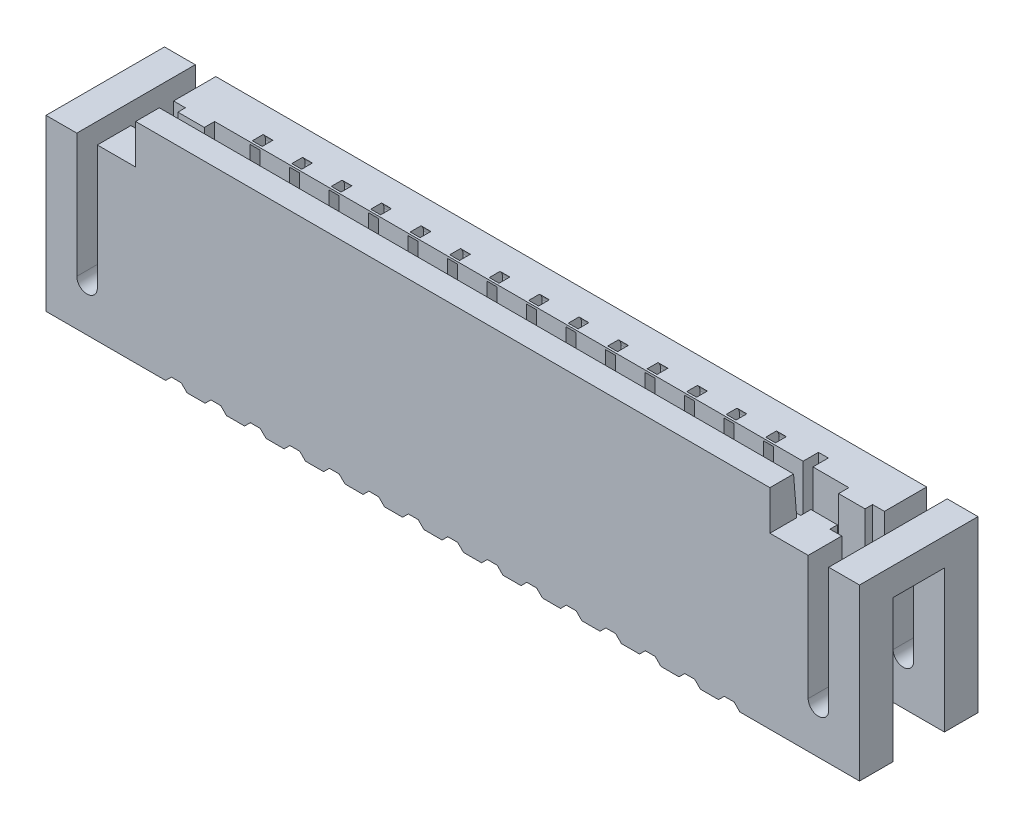
from build123d import *

# Parameters (mm, degrees)
BOSS_EXTRUDE1_DEPTH             = 3
CUT_EXTRUDE1_DEPTH              = 19.761966848
SKETCH3_W                       = 16.06
SKETCH3_H                       = 1.22
CUT_EXTRUDE2_DEPTH              = 3
CUT_EXTRUDE3_DEPTH              = 12.557681428
CUT_EXTRUDE3_DEPTH_BACK         = 12.557681428
F_1_1_START                     = -7.13
F_1_1_PART_1_METAL_PIN_DEPTH    = 0.25
F_1_1_START_2                   = -6.13
F_1_1_PART_1_METAL_PIN_2_DEPTH  = 0.25
F_1_1_START_3                   = -5.13
F_1_1_PART_1_METAL_PIN_3_DEPTH  = 0.25
F_1_1_START_4                   = -4.13
F_1_1_PART_1_METAL_PIN_4_DEPTH  = 0.25
F_1_1_START_5                   = -3.13
F_1_1_PART_1_METAL_PIN_5_DEPTH  = 0.25
F_1_1_START_6                   = -2.13
F_1_1_PART_1_METAL_PIN_6_DEPTH  = 0.25
F_1_1_START_7                   = -1.13
F_1_1_PART_1_METAL_PIN_7_DEPTH  = 0.25
F_1_1_START_8                   = -0.13
F_1_1_PART_1_METAL_PIN_8_DEPTH  = 0.25
F_1_1_START_9                   = 0.87
F_1_1_PART_1_METAL_PIN_9_DEPTH  = 0.25
F_1_1_START_10                  = 1.87
F_1_1_PART_1_METAL_PIN_10_DEPTH = 0.25
F_1_1_START_11                  = 2.87
F_1_1_PART_1_METAL_PIN_11_DEPTH = 0.25
F_1_1_START_12                  = 3.87
F_1_1_PART_1_METAL_PIN_12_DEPTH = 0.25
F_1_1_START_13                  = 4.87
F_1_1_PART_1_METAL_PIN_13_DEPTH = 0.25
F_1_1_START_14                  = 5.87
F_1_1_PART_1_METAL_PIN_14_DEPTH = 0.25
F_1_1_START_15                  = 6.87
F_1_1_PART_1_METAL_PIN_15_DEPTH = 0.25
SKETCH5_W                       = 1.3
SKETCH5_H                       = 3.6
CUT_EXTRUDE4_DEPTH              = 1.6
CUT_EXTRUDE5_DEPTH              = 1.6
SKETCH8_W                       = 0.3
SKETCH8_H                       = 1.3
BOSS_EXTRUDE3_DEPTH             = 0.3
CUT_EXTRUDE6_REACH              = 13.558
SKETCH9_W                       = 0.97
SKETCH9_H                       = 0.7
SKETCH10_W                      = 1.3
SKETCH10_H                      = 0.995055469
CUT_EXTRUDE7_DEPTH              = 0.3
SKETCH11_W                      = 1.3
SKETCH11_H                      = 1.339878891
CUT_EXTRUDE8_DEPTH              = 0.3
SKETCH12_W                      = 0.22
SKETCH12_H                      = 2.3
BOSS_EXTRUDE4_DEPTH             = 0.3


# Read off the part's stored shape, not the designer's step: 1.1 part 1 metal pin
with BuildPart() as part:
    # Sketch1 → Boss-Extrude1 (new body)
    with BuildSketch(Plane.XY):
        with BuildLine():
            Line((4.729085478, -2.65), (4.875, -2.504085478))
            Line((4.875, -2.504085478), (5.125, -2.504085478))
            Line((5.125, -2.504085478), (5.270914522, -2.65))
            Line((5.270914522, -2.65), (5.729085478, -2.65))
            Line((5.729085478, -2.65), (5.875, -2.504085478))
            Line((5.875, -2.504085478), (6.125, -2.504085478))
            Line((6.125, -2.504085478), (6.270914522, -2.65))
            Line((6.270914522, -2.65), (6.729085478, -2.65))
            Line((6.729085478, -2.65), (6.875, -2.504085478))
            Line((6.875, -2.504085478), (7.125, -2.504085478))
            Line((7.125, -2.504085478), (7.270914522, -2.65))
            Line((7.270914522, -2.65), (10.3, -2.65))
            Line((10.3, -2.65), (10.3, 1.65))
            Line((10.3, 1.65), (9.52, 1.65))
            Line((9.52, 1.65), (9.52, -1.49))
            ThreePointArc((9.52, -1.49), (9.26, -1.75), (9, -1.49))
            Line((9, -1.49), (9, 1.65))
            Line((9, 1.65), (8.03, 1.65))
            Line((8.03, 1.65), (8.03, 2.65))
            Line((8.03, 2.65), (-8.03, 2.65))
            Line((-8.03, 2.65), (-8.03, 1.65))
            Line((-8.03, 1.65), (-9, 1.65))
            Line((-9, 1.65), (-9, -1.49))
            ThreePointArc((-9, -1.49), (-9.26, -1.75), (-9.52, -1.49))
            Line((-9.52, -1.49), (-9.52, 1.65))
            Line((-9.52, 1.65), (-10.3, 1.65))
            Line((-10.3, 1.65), (-10.3, -2.65))
            Line((-10.3, -2.65), (-7.270914522, -2.65))
            Line((-7.270914522, -2.65), (-7.125, -2.504085478))
            Line((-7.125, -2.504085478), (-6.875, -2.504085478))
            Line((-6.875, -2.504085478), (-6.729085478, -2.65))
            Line((-6.729085478, -2.65), (-6.270914522, -2.65))
            Line((-6.270914522, -2.65), (-6.125, -2.504085478))
            Line((-6.125, -2.504085478), (-5.875, -2.504085478))
            Line((-5.875, -2.504085478), (-5.729085478, -2.65))
            Line((-5.729085478, -2.65), (-5.270914522, -2.65))
            Line((-5.270914522, -2.65), (-5.125, -2.504085478))
            Line((-5.125, -2.504085478), (-4.875, -2.504085478))
            Line((-4.875, -2.504085478), (-4.729085478, -2.65))
            Line((-4.729085478, -2.65), (-4.270914522, -2.65))
            Line((-4.270914522, -2.65), (-4.125, -2.504085478))
            Line((-4.125, -2.504085478), (-3.875, -2.504085478))
            Line((-3.875, -2.504085478), (-3.729085478, -2.65))
            Line((-3.729085478, -2.65), (-3.270914522, -2.65))
            Line((-3.270914522, -2.65), (-3.125, -2.504085478))
            Line((-3.125, -2.504085478), (-2.875, -2.504085478))
            Line((-2.875, -2.504085478), (-2.729085478, -2.65))
            Line((-2.729085478, -2.65), (-2.270914522, -2.65))
            Line((-2.270914522, -2.65), (-2.125, -2.504085478))
            Line((-2.125, -2.504085478), (-1.875, -2.504085478))
            Line((-1.875, -2.504085478), (-1.729085478, -2.65))
            Line((-1.729085478, -2.65), (-1.270914522, -2.65))
            Line((-1.270914522, -2.65), (-1.125, -2.504085478))
            Line((-1.125, -2.504085478), (-0.875, -2.504085478))
            Line((-0.875, -2.504085478), (-0.729085478, -2.65))
            Line((-0.729085478, -2.65), (-0.270914522, -2.65))
            Line((-0.270914522, -2.65), (-0.125, -2.504085478))
            Line((-0.125, -2.504085478), (0.125, -2.504085478))
            Line((0.125, -2.504085478), (0.270914522, -2.65))
            Line((0.270914522, -2.65), (0.729085478, -2.65))
            Line((0.729085478, -2.65), (0.875, -2.504085478))
            Line((0.875, -2.504085478), (1.125, -2.504085478))
            Line((1.125, -2.504085478), (1.270914522, -2.65))
            Line((1.270914522, -2.65), (1.729085478, -2.65))
            Line((1.729085478, -2.65), (1.875, -2.504085478))
            Line((1.875, -2.504085478), (2.125, -2.504085478))
            Line((2.125, -2.504085478), (2.270914522, -2.65))
            Line((2.270914522, -2.65), (2.729085478, -2.65))
            Line((2.729085478, -2.65), (2.875, -2.504085478))
            Line((2.875, -2.504085478), (3.125, -2.504085478))
            Line((3.125, -2.504085478), (3.270914522, -2.65))
            Line((3.270914522, -2.65), (3.729085478, -2.65))
            Line((3.729085478, -2.65), (3.875, -2.504085478))
            Line((3.875, -2.504085478), (4.125, -2.504085478))
            Line((4.125, -2.504085478), (4.270914522, -2.65))
            Line((4.270914522, -2.65), (4.729085478, -2.65))
        make_face()
    extrude(amount=BOSS_EXTRUDE1_DEPTH)

    # Sketch2 → Cut-Extrude1 (cut, through all)
    with BuildSketch(Plane(origin=(8.03, 0, 0), x_dir=(0, 0, -1), z_dir=(1, 0, 0))):
        Polygon((-2.4, 2.65), (-2.32, 1.65), (0.208388731, 1.65), (0.247686287, 2.908353898), align=None)
    extrude(amount=-CUT_EXTRUDE1_DEPTH, mode=Mode.SUBTRACT)

    # Sketch3 → Cut-Extrude2 (cut)
    with BuildSketch(Plane(origin=(0, 1.65, 0), x_dir=(1, 0, 0), z_dir=(0, 1, 0))):
        with Locations((0, -1.61)):
            Rectangle(SKETCH3_W, SKETCH3_H)
    extrude(amount=-CUT_EXTRUDE2_DEPTH, mode=Mode.SUBTRACT)

    # Sketch4 → Cut-Extrude3 (cut, two sides: drawn at the far end of the back side and taken through both)
    with BuildSketch(Plane(origin=(0, 1.65, 0), x_dir=(1, 0, 0), z_dir=(0, 1, 0)).offset(-CUT_EXTRUDE3_DEPTH_BACK)):
        Polygon((7.12, -1), (7.12, -0.61), (6.87, -0.61), (6.87, -1.06), (7.12, -1.06), align=None)
    extrude(amount=CUT_EXTRUDE3_DEPTH + CUT_EXTRUDE3_DEPTH_BACK, mode=Mode.SUBTRACT)


with BuildPart() as body_2:
    # 1.1 part 1 metal pin outline → 1.1 part 1 metal pin (new body)
    with BuildSketch(Plane.YZ.offset(F_1_1_START)):
        with BuildLine():
            Line((-1.194039738, 2.656451651), (-2.18961773, 2.656451651))
            Line((-2.18961773, 2.656451651), (-2.504085478, 2.970919399))
            Line((-2.504085478, 2.970919399), (-2.504085478, 3.951010546))
            ThreePointArc((-2.504085478, 3.951010546), (-2.677042739, 4.123967807), (-2.85, 3.951010546))
            Line((-2.85, 3.951010546), (-2.85, 2.60404036))
            Line((-2.85, 2.60404036), (-2.745177417, 2.570219382))
            Line((-2.745177417, 2.570219382), (-2.745177417, 0.672930638))
            Line((-2.745177417, 0.672930638), (-2.85, 0.612411291))
            Line((-2.85, 0.612411291), (-2.85, -0.52491373))
            ThreePointArc((-2.85, -0.52491373), (-2.677042739, -0.697870991), (-2.504085478, -0.52491373))
            Line((-2.504085478, -0.52491373), (-2.504085478, 0.245532252))
            Line((-2.504085478, 0.245532252), (-2.18961773, 0.56))
            Line((-2.18961773, 0.56), (-1.194039738, 0.56))
            Line((-1.194039738, 0.56), (-1.144039738, 0.61))
            Line((-1.144039738, 0.61), (1.504047418, 0.61))
            ThreePointArc((1.504047418, 0.61), (1.688823325, 0.733463313), (1.645468774, 0.951421356))
            Line((1.645468774, 0.951421356), (1.586890131, 1.01))
            Line((1.586890131, 1.01), (-0.7626457, 1.01))
            Line((-0.7626457, 1.01), (-0.9126457, 1.16))
            Line((-0.9126457, 1.16), (-1.165104327, 1.16))
            Line((-1.165104327, 1.16), (-1.265104327, 1.06))
            Line((-1.265104327, 1.06), (-1.766799307, 1.06))
            ThreePointArc((-1.766799307, 1.06), (-1.837509986, 1.089289321), (-1.866799307, 1.16))
            Line((-1.866799307, 1.16), (-1.866799307, 1.736611231))
            ThreePointArc((-1.866799307, 1.736611231), (-1.837509985, 1.807321909), (-1.766799307, 1.836611231))
            Line((-1.766799307, 1.836611231), (-1.261862956, 1.836611231))
            ThreePointArc((-1.261862956, 1.836611231), (-1.164124169, 1.800396685), (-1.066385382, 1.836611231))
            Line((-1.066385382, 1.836611231), (-0.709080744, 2.143526753))
            Line((-0.709080744, 2.143526753), (1.122327869, 1.918658051))
            ThreePointArc((1.122327869, 1.918658051), (1.262579084, 1.846243032), (1.416183018, 1.882577175))
            Line((1.416183018, 1.882577175), (1.815354631, 2.147954425))
            ThreePointArc((1.815354631, 2.147954425), (1.836330139, 2.201101995), (1.793766345, 2.239219702))
            Line((1.793766345, 2.239219702), (-1.136613148, 2.599025062))
            Line((-1.136613148, 2.599025062), (-1.194039738, 2.656451651))
        make_face()
    extrude(amount=F_1_1_PART_1_METAL_PIN_DEPTH)


with BuildPart() as body_3:
    # 1.1 part 1 metal pin 2 outline → 1.1 part 1 metal pin 2 (new body)
    with BuildSketch(Plane.YZ.offset(F_1_1_START_2)):
        with BuildLine():
            Line((-1.194039738, 2.656451651), (-2.18961773, 2.656451651))
            Line((-2.18961773, 2.656451651), (-2.504085478, 2.970919399))
            Line((-2.504085478, 2.970919399), (-2.504085478, 3.951010546))
            ThreePointArc((-2.504085478, 3.951010546), (-2.677042739, 4.123967807), (-2.85, 3.951010546))
            Line((-2.85, 3.951010546), (-2.85, 2.60404036))
            Line((-2.85, 2.60404036), (-2.745177417, 2.570219382))
            Line((-2.745177417, 2.570219382), (-2.745177417, 0.672930638))
            Line((-2.745177417, 0.672930638), (-2.85, 0.612411291))
            Line((-2.85, 0.612411291), (-2.85, -0.52491373))
            ThreePointArc((-2.85, -0.52491373), (-2.677042739, -0.697870991), (-2.504085478, -0.52491373))
            Line((-2.504085478, -0.52491373), (-2.504085478, 0.245532252))
            Line((-2.504085478, 0.245532252), (-2.18961773, 0.56))
            Line((-2.18961773, 0.56), (-1.194039738, 0.56))
            Line((-1.194039738, 0.56), (-1.144039738, 0.61))
            Line((-1.144039738, 0.61), (1.504047418, 0.61))
            ThreePointArc((1.504047418, 0.61), (1.688823325, 0.733463313), (1.645468774, 0.951421356))
            Line((1.645468774, 0.951421356), (1.586890131, 1.01))
            Line((1.586890131, 1.01), (-0.7626457, 1.01))
            Line((-0.7626457, 1.01), (-0.9126457, 1.16))
            Line((-0.9126457, 1.16), (-1.165104327, 1.16))
            Line((-1.165104327, 1.16), (-1.265104327, 1.06))
            Line((-1.265104327, 1.06), (-1.766799307, 1.06))
            ThreePointArc((-1.766799307, 1.06), (-1.837509986, 1.089289321), (-1.866799307, 1.16))
            Line((-1.866799307, 1.16), (-1.866799307, 1.736611231))
            ThreePointArc((-1.866799307, 1.736611231), (-1.837509985, 1.807321909), (-1.766799307, 1.836611231))
            Line((-1.766799307, 1.836611231), (-1.261862956, 1.836611231))
            ThreePointArc((-1.261862956, 1.836611231), (-1.164124169, 1.800396685), (-1.066385382, 1.836611231))
            Line((-1.066385382, 1.836611231), (-0.709080744, 2.143526753))
            Line((-0.709080744, 2.143526753), (1.122327869, 1.918658051))
            ThreePointArc((1.122327869, 1.918658051), (1.262579084, 1.846243032), (1.416183018, 1.882577175))
            Line((1.416183018, 1.882577175), (1.815354631, 2.147954425))
            ThreePointArc((1.815354631, 2.147954425), (1.836330139, 2.201101995), (1.793766345, 2.239219702))
            Line((1.793766345, 2.239219702), (-1.136613148, 2.599025062))
            Line((-1.136613148, 2.599025062), (-1.194039738, 2.656451651))
        make_face()
    extrude(amount=F_1_1_PART_1_METAL_PIN_2_DEPTH)


with BuildPart() as body_4:
    # 1.1 part 1 metal pin 3 outline → 1.1 part 1 metal pin 3 (new body)
    with BuildSketch(Plane.YZ.offset(F_1_1_START_3)):
        with BuildLine():
            Line((-1.194039738, 2.656451651), (-2.18961773, 2.656451651))
            Line((-2.18961773, 2.656451651), (-2.504085478, 2.970919399))
            Line((-2.504085478, 2.970919399), (-2.504085478, 3.951010546))
            ThreePointArc((-2.504085478, 3.951010546), (-2.677042739, 4.123967807), (-2.85, 3.951010546))
            Line((-2.85, 3.951010546), (-2.85, 2.60404036))
            Line((-2.85, 2.60404036), (-2.745177417, 2.570219382))
            Line((-2.745177417, 2.570219382), (-2.745177417, 0.672930638))
            Line((-2.745177417, 0.672930638), (-2.85, 0.612411291))
            Line((-2.85, 0.612411291), (-2.85, -0.52491373))
            ThreePointArc((-2.85, -0.52491373), (-2.677042739, -0.697870991), (-2.504085478, -0.52491373))
            Line((-2.504085478, -0.52491373), (-2.504085478, 0.245532252))
            Line((-2.504085478, 0.245532252), (-2.18961773, 0.56))
            Line((-2.18961773, 0.56), (-1.194039738, 0.56))
            Line((-1.194039738, 0.56), (-1.144039738, 0.61))
            Line((-1.144039738, 0.61), (1.504047418, 0.61))
            ThreePointArc((1.504047418, 0.61), (1.688823325, 0.733463313), (1.645468774, 0.951421356))
            Line((1.645468774, 0.951421356), (1.586890131, 1.01))
            Line((1.586890131, 1.01), (-0.7626457, 1.01))
            Line((-0.7626457, 1.01), (-0.9126457, 1.16))
            Line((-0.9126457, 1.16), (-1.165104327, 1.16))
            Line((-1.165104327, 1.16), (-1.265104327, 1.06))
            Line((-1.265104327, 1.06), (-1.766799307, 1.06))
            ThreePointArc((-1.766799307, 1.06), (-1.837509986, 1.089289321), (-1.866799307, 1.16))
            Line((-1.866799307, 1.16), (-1.866799307, 1.736611231))
            ThreePointArc((-1.866799307, 1.736611231), (-1.837509985, 1.807321909), (-1.766799307, 1.836611231))
            Line((-1.766799307, 1.836611231), (-1.261862956, 1.836611231))
            ThreePointArc((-1.261862956, 1.836611231), (-1.164124169, 1.800396685), (-1.066385382, 1.836611231))
            Line((-1.066385382, 1.836611231), (-0.709080744, 2.143526753))
            Line((-0.709080744, 2.143526753), (1.122327869, 1.918658051))
            ThreePointArc((1.122327869, 1.918658051), (1.262579084, 1.846243032), (1.416183018, 1.882577175))
            Line((1.416183018, 1.882577175), (1.815354631, 2.147954425))
            ThreePointArc((1.815354631, 2.147954425), (1.836330139, 2.201101995), (1.793766345, 2.239219702))
            Line((1.793766345, 2.239219702), (-1.136613148, 2.599025062))
            Line((-1.136613148, 2.599025062), (-1.194039738, 2.656451651))
        make_face()
    extrude(amount=F_1_1_PART_1_METAL_PIN_3_DEPTH)


with BuildPart() as body_5:
    # 1.1 part 1 metal pin 4 outline → 1.1 part 1 metal pin 4 (new body)
    with BuildSketch(Plane.YZ.offset(F_1_1_START_4)):
        with BuildLine():
            Line((-1.194039738, 2.656451651), (-2.18961773, 2.656451651))
            Line((-2.18961773, 2.656451651), (-2.504085478, 2.970919399))
            Line((-2.504085478, 2.970919399), (-2.504085478, 3.951010546))
            ThreePointArc((-2.504085478, 3.951010546), (-2.677042739, 4.123967807), (-2.85, 3.951010546))
            Line((-2.85, 3.951010546), (-2.85, 2.60404036))
            Line((-2.85, 2.60404036), (-2.745177417, 2.570219382))
            Line((-2.745177417, 2.570219382), (-2.745177417, 0.672930638))
            Line((-2.745177417, 0.672930638), (-2.85, 0.612411291))
            Line((-2.85, 0.612411291), (-2.85, -0.52491373))
            ThreePointArc((-2.85, -0.52491373), (-2.677042739, -0.697870991), (-2.504085478, -0.52491373))
            Line((-2.504085478, -0.52491373), (-2.504085478, 0.245532252))
            Line((-2.504085478, 0.245532252), (-2.18961773, 0.56))
            Line((-2.18961773, 0.56), (-1.194039738, 0.56))
            Line((-1.194039738, 0.56), (-1.144039738, 0.61))
            Line((-1.144039738, 0.61), (1.504047418, 0.61))
            ThreePointArc((1.504047418, 0.61), (1.688823325, 0.733463313), (1.645468774, 0.951421356))
            Line((1.645468774, 0.951421356), (1.586890131, 1.01))
            Line((1.586890131, 1.01), (-0.7626457, 1.01))
            Line((-0.7626457, 1.01), (-0.9126457, 1.16))
            Line((-0.9126457, 1.16), (-1.165104327, 1.16))
            Line((-1.165104327, 1.16), (-1.265104327, 1.06))
            Line((-1.265104327, 1.06), (-1.766799307, 1.06))
            ThreePointArc((-1.766799307, 1.06), (-1.837509986, 1.089289321), (-1.866799307, 1.16))
            Line((-1.866799307, 1.16), (-1.866799307, 1.736611231))
            ThreePointArc((-1.866799307, 1.736611231), (-1.837509985, 1.807321909), (-1.766799307, 1.836611231))
            Line((-1.766799307, 1.836611231), (-1.261862956, 1.836611231))
            ThreePointArc((-1.261862956, 1.836611231), (-1.164124169, 1.800396685), (-1.066385382, 1.836611231))
            Line((-1.066385382, 1.836611231), (-0.709080744, 2.143526753))
            Line((-0.709080744, 2.143526753), (1.122327869, 1.918658051))
            ThreePointArc((1.122327869, 1.918658051), (1.262579084, 1.846243032), (1.416183018, 1.882577175))
            Line((1.416183018, 1.882577175), (1.815354631, 2.147954425))
            ThreePointArc((1.815354631, 2.147954425), (1.836330139, 2.201101995), (1.793766345, 2.239219702))
            Line((1.793766345, 2.239219702), (-1.136613148, 2.599025062))
            Line((-1.136613148, 2.599025062), (-1.194039738, 2.656451651))
        make_face()
    extrude(amount=F_1_1_PART_1_METAL_PIN_4_DEPTH)


with BuildPart() as body_6:
    # 1.1 part 1 metal pin 5 outline → 1.1 part 1 metal pin 5 (new body)
    with BuildSketch(Plane.YZ.offset(F_1_1_START_5)):
        with BuildLine():
            Line((-1.194039738, 2.656451651), (-2.18961773, 2.656451651))
            Line((-2.18961773, 2.656451651), (-2.504085478, 2.970919399))
            Line((-2.504085478, 2.970919399), (-2.504085478, 3.951010546))
            ThreePointArc((-2.504085478, 3.951010546), (-2.677042739, 4.123967807), (-2.85, 3.951010546))
            Line((-2.85, 3.951010546), (-2.85, 2.60404036))
            Line((-2.85, 2.60404036), (-2.745177417, 2.570219382))
            Line((-2.745177417, 2.570219382), (-2.745177417, 0.672930638))
            Line((-2.745177417, 0.672930638), (-2.85, 0.612411291))
            Line((-2.85, 0.612411291), (-2.85, -0.52491373))
            ThreePointArc((-2.85, -0.52491373), (-2.677042739, -0.697870991), (-2.504085478, -0.52491373))
            Line((-2.504085478, -0.52491373), (-2.504085478, 0.245532252))
            Line((-2.504085478, 0.245532252), (-2.18961773, 0.56))
            Line((-2.18961773, 0.56), (-1.194039738, 0.56))
            Line((-1.194039738, 0.56), (-1.144039738, 0.61))
            Line((-1.144039738, 0.61), (1.504047418, 0.61))
            ThreePointArc((1.504047418, 0.61), (1.688823325, 0.733463313), (1.645468774, 0.951421356))
            Line((1.645468774, 0.951421356), (1.586890131, 1.01))
            Line((1.586890131, 1.01), (-0.7626457, 1.01))
            Line((-0.7626457, 1.01), (-0.9126457, 1.16))
            Line((-0.9126457, 1.16), (-1.165104327, 1.16))
            Line((-1.165104327, 1.16), (-1.265104327, 1.06))
            Line((-1.265104327, 1.06), (-1.766799307, 1.06))
            ThreePointArc((-1.766799307, 1.06), (-1.837509986, 1.089289321), (-1.866799307, 1.16))
            Line((-1.866799307, 1.16), (-1.866799307, 1.736611231))
            ThreePointArc((-1.866799307, 1.736611231), (-1.837509985, 1.807321909), (-1.766799307, 1.836611231))
            Line((-1.766799307, 1.836611231), (-1.261862956, 1.836611231))
            ThreePointArc((-1.261862956, 1.836611231), (-1.164124169, 1.800396685), (-1.066385382, 1.836611231))
            Line((-1.066385382, 1.836611231), (-0.709080744, 2.143526753))
            Line((-0.709080744, 2.143526753), (1.122327869, 1.918658051))
            ThreePointArc((1.122327869, 1.918658051), (1.262579084, 1.846243032), (1.416183018, 1.882577175))
            Line((1.416183018, 1.882577175), (1.815354631, 2.147954425))
            ThreePointArc((1.815354631, 2.147954425), (1.836330139, 2.201101995), (1.793766345, 2.239219702))
            Line((1.793766345, 2.239219702), (-1.136613148, 2.599025062))
            Line((-1.136613148, 2.599025062), (-1.194039738, 2.656451651))
        make_face()
    extrude(amount=F_1_1_PART_1_METAL_PIN_5_DEPTH)


with BuildPart() as body_7:
    # 1.1 part 1 metal pin 6 outline → 1.1 part 1 metal pin 6 (new body)
    with BuildSketch(Plane.YZ.offset(F_1_1_START_6)):
        with BuildLine():
            Line((-1.194039738, 2.656451651), (-2.18961773, 2.656451651))
            Line((-2.18961773, 2.656451651), (-2.504085478, 2.970919399))
            Line((-2.504085478, 2.970919399), (-2.504085478, 3.951010546))
            ThreePointArc((-2.504085478, 3.951010546), (-2.677042739, 4.123967807), (-2.85, 3.951010546))
            Line((-2.85, 3.951010546), (-2.85, 2.60404036))
            Line((-2.85, 2.60404036), (-2.745177417, 2.570219382))
            Line((-2.745177417, 2.570219382), (-2.745177417, 0.672930638))
            Line((-2.745177417, 0.672930638), (-2.85, 0.612411291))
            Line((-2.85, 0.612411291), (-2.85, -0.52491373))
            ThreePointArc((-2.85, -0.52491373), (-2.677042739, -0.697870991), (-2.504085478, -0.52491373))
            Line((-2.504085478, -0.52491373), (-2.504085478, 0.245532252))
            Line((-2.504085478, 0.245532252), (-2.18961773, 0.56))
            Line((-2.18961773, 0.56), (-1.194039738, 0.56))
            Line((-1.194039738, 0.56), (-1.144039738, 0.61))
            Line((-1.144039738, 0.61), (1.504047418, 0.61))
            ThreePointArc((1.504047418, 0.61), (1.688823325, 0.733463313), (1.645468774, 0.951421356))
            Line((1.645468774, 0.951421356), (1.586890131, 1.01))
            Line((1.586890131, 1.01), (-0.7626457, 1.01))
            Line((-0.7626457, 1.01), (-0.9126457, 1.16))
            Line((-0.9126457, 1.16), (-1.165104327, 1.16))
            Line((-1.165104327, 1.16), (-1.265104327, 1.06))
            Line((-1.265104327, 1.06), (-1.766799307, 1.06))
            ThreePointArc((-1.766799307, 1.06), (-1.837509986, 1.089289321), (-1.866799307, 1.16))
            Line((-1.866799307, 1.16), (-1.866799307, 1.736611231))
            ThreePointArc((-1.866799307, 1.736611231), (-1.837509985, 1.807321909), (-1.766799307, 1.836611231))
            Line((-1.766799307, 1.836611231), (-1.261862956, 1.836611231))
            ThreePointArc((-1.261862956, 1.836611231), (-1.164124169, 1.800396685), (-1.066385382, 1.836611231))
            Line((-1.066385382, 1.836611231), (-0.709080744, 2.143526753))
            Line((-0.709080744, 2.143526753), (1.122327869, 1.918658051))
            ThreePointArc((1.122327869, 1.918658051), (1.262579084, 1.846243032), (1.416183018, 1.882577175))
            Line((1.416183018, 1.882577175), (1.815354631, 2.147954425))
            ThreePointArc((1.815354631, 2.147954425), (1.836330139, 2.201101995), (1.793766345, 2.239219702))
            Line((1.793766345, 2.239219702), (-1.136613148, 2.599025062))
            Line((-1.136613148, 2.599025062), (-1.194039738, 2.656451651))
        make_face()
    extrude(amount=F_1_1_PART_1_METAL_PIN_6_DEPTH)


with BuildPart() as body_8:
    # 1.1 part 1 metal pin 7 outline → 1.1 part 1 metal pin 7 (new body)
    with BuildSketch(Plane.YZ.offset(F_1_1_START_7)):
        with BuildLine():
            Line((-1.194039738, 2.656451651), (-2.18961773, 2.656451651))
            Line((-2.18961773, 2.656451651), (-2.504085478, 2.970919399))
            Line((-2.504085478, 2.970919399), (-2.504085478, 3.951010546))
            ThreePointArc((-2.504085478, 3.951010546), (-2.677042739, 4.123967807), (-2.85, 3.951010546))
            Line((-2.85, 3.951010546), (-2.85, 2.60404036))
            Line((-2.85, 2.60404036), (-2.745177417, 2.570219382))
            Line((-2.745177417, 2.570219382), (-2.745177417, 0.672930638))
            Line((-2.745177417, 0.672930638), (-2.85, 0.612411291))
            Line((-2.85, 0.612411291), (-2.85, -0.52491373))
            ThreePointArc((-2.85, -0.52491373), (-2.677042739, -0.697870991), (-2.504085478, -0.52491373))
            Line((-2.504085478, -0.52491373), (-2.504085478, 0.245532252))
            Line((-2.504085478, 0.245532252), (-2.18961773, 0.56))
            Line((-2.18961773, 0.56), (-1.194039738, 0.56))
            Line((-1.194039738, 0.56), (-1.144039738, 0.61))
            Line((-1.144039738, 0.61), (1.504047418, 0.61))
            ThreePointArc((1.504047418, 0.61), (1.688823325, 0.733463313), (1.645468774, 0.951421356))
            Line((1.645468774, 0.951421356), (1.586890131, 1.01))
            Line((1.586890131, 1.01), (-0.7626457, 1.01))
            Line((-0.7626457, 1.01), (-0.9126457, 1.16))
            Line((-0.9126457, 1.16), (-1.165104327, 1.16))
            Line((-1.165104327, 1.16), (-1.265104327, 1.06))
            Line((-1.265104327, 1.06), (-1.766799307, 1.06))
            ThreePointArc((-1.766799307, 1.06), (-1.837509986, 1.089289321), (-1.866799307, 1.16))
            Line((-1.866799307, 1.16), (-1.866799307, 1.736611231))
            ThreePointArc((-1.866799307, 1.736611231), (-1.837509985, 1.807321909), (-1.766799307, 1.836611231))
            Line((-1.766799307, 1.836611231), (-1.261862956, 1.836611231))
            ThreePointArc((-1.261862956, 1.836611231), (-1.164124169, 1.800396685), (-1.066385382, 1.836611231))
            Line((-1.066385382, 1.836611231), (-0.709080744, 2.143526753))
            Line((-0.709080744, 2.143526753), (1.122327869, 1.918658051))
            ThreePointArc((1.122327869, 1.918658051), (1.262579084, 1.846243032), (1.416183018, 1.882577175))
            Line((1.416183018, 1.882577175), (1.815354631, 2.147954425))
            ThreePointArc((1.815354631, 2.147954425), (1.836330139, 2.201101995), (1.793766345, 2.239219702))
            Line((1.793766345, 2.239219702), (-1.136613148, 2.599025062))
            Line((-1.136613148, 2.599025062), (-1.194039738, 2.656451651))
        make_face()
    extrude(amount=F_1_1_PART_1_METAL_PIN_7_DEPTH)


with BuildPart() as body_9:
    # 1.1 part 1 metal pin 8 outline → 1.1 part 1 metal pin 8 (new body)
    with BuildSketch(Plane.YZ.offset(F_1_1_START_8)):
        with BuildLine():
            Line((-1.194039738, 2.656451651), (-2.18961773, 2.656451651))
            Line((-2.18961773, 2.656451651), (-2.504085478, 2.970919399))
            Line((-2.504085478, 2.970919399), (-2.504085478, 3.951010546))
            ThreePointArc((-2.504085478, 3.951010546), (-2.677042739, 4.123967807), (-2.85, 3.951010546))
            Line((-2.85, 3.951010546), (-2.85, 2.60404036))
            Line((-2.85, 2.60404036), (-2.745177417, 2.570219382))
            Line((-2.745177417, 2.570219382), (-2.745177417, 0.672930638))
            Line((-2.745177417, 0.672930638), (-2.85, 0.612411291))
            Line((-2.85, 0.612411291), (-2.85, -0.52491373))
            ThreePointArc((-2.85, -0.52491373), (-2.677042739, -0.697870991), (-2.504085478, -0.52491373))
            Line((-2.504085478, -0.52491373), (-2.504085478, 0.245532252))
            Line((-2.504085478, 0.245532252), (-2.18961773, 0.56))
            Line((-2.18961773, 0.56), (-1.194039738, 0.56))
            Line((-1.194039738, 0.56), (-1.144039738, 0.61))
            Line((-1.144039738, 0.61), (1.504047418, 0.61))
            ThreePointArc((1.504047418, 0.61), (1.688823325, 0.733463313), (1.645468774, 0.951421356))
            Line((1.645468774, 0.951421356), (1.586890131, 1.01))
            Line((1.586890131, 1.01), (-0.7626457, 1.01))
            Line((-0.7626457, 1.01), (-0.9126457, 1.16))
            Line((-0.9126457, 1.16), (-1.165104327, 1.16))
            Line((-1.165104327, 1.16), (-1.265104327, 1.06))
            Line((-1.265104327, 1.06), (-1.766799307, 1.06))
            ThreePointArc((-1.766799307, 1.06), (-1.837509986, 1.089289321), (-1.866799307, 1.16))
            Line((-1.866799307, 1.16), (-1.866799307, 1.736611231))
            ThreePointArc((-1.866799307, 1.736611231), (-1.837509985, 1.807321909), (-1.766799307, 1.836611231))
            Line((-1.766799307, 1.836611231), (-1.261862956, 1.836611231))
            ThreePointArc((-1.261862956, 1.836611231), (-1.164124169, 1.800396685), (-1.066385382, 1.836611231))
            Line((-1.066385382, 1.836611231), (-0.709080744, 2.143526753))
            Line((-0.709080744, 2.143526753), (1.122327869, 1.918658051))
            ThreePointArc((1.122327869, 1.918658051), (1.262579084, 1.846243032), (1.416183018, 1.882577175))
            Line((1.416183018, 1.882577175), (1.815354631, 2.147954425))
            ThreePointArc((1.815354631, 2.147954425), (1.836330139, 2.201101995), (1.793766345, 2.239219702))
            Line((1.793766345, 2.239219702), (-1.136613148, 2.599025062))
            Line((-1.136613148, 2.599025062), (-1.194039738, 2.656451651))
        make_face()
    extrude(amount=F_1_1_PART_1_METAL_PIN_8_DEPTH)


with BuildPart() as body_10:
    # 1.1 part 1 metal pin 9 outline → 1.1 part 1 metal pin 9 (new body)
    with BuildSketch(Plane.YZ.offset(F_1_1_START_9)):
        with BuildLine():
            Line((-1.194039738, 2.656451651), (-2.18961773, 2.656451651))
            Line((-2.18961773, 2.656451651), (-2.504085478, 2.970919399))
            Line((-2.504085478, 2.970919399), (-2.504085478, 3.951010546))
            ThreePointArc((-2.504085478, 3.951010546), (-2.677042739, 4.123967807), (-2.85, 3.951010546))
            Line((-2.85, 3.951010546), (-2.85, 2.60404036))
            Line((-2.85, 2.60404036), (-2.745177417, 2.570219382))
            Line((-2.745177417, 2.570219382), (-2.745177417, 0.672930638))
            Line((-2.745177417, 0.672930638), (-2.85, 0.612411291))
            Line((-2.85, 0.612411291), (-2.85, -0.52491373))
            ThreePointArc((-2.85, -0.52491373), (-2.677042739, -0.697870991), (-2.504085478, -0.52491373))
            Line((-2.504085478, -0.52491373), (-2.504085478, 0.245532252))
            Line((-2.504085478, 0.245532252), (-2.18961773, 0.56))
            Line((-2.18961773, 0.56), (-1.194039738, 0.56))
            Line((-1.194039738, 0.56), (-1.144039738, 0.61))
            Line((-1.144039738, 0.61), (1.504047418, 0.61))
            ThreePointArc((1.504047418, 0.61), (1.688823325, 0.733463313), (1.645468774, 0.951421356))
            Line((1.645468774, 0.951421356), (1.586890131, 1.01))
            Line((1.586890131, 1.01), (-0.7626457, 1.01))
            Line((-0.7626457, 1.01), (-0.9126457, 1.16))
            Line((-0.9126457, 1.16), (-1.165104327, 1.16))
            Line((-1.165104327, 1.16), (-1.265104327, 1.06))
            Line((-1.265104327, 1.06), (-1.766799307, 1.06))
            ThreePointArc((-1.766799307, 1.06), (-1.837509986, 1.089289321), (-1.866799307, 1.16))
            Line((-1.866799307, 1.16), (-1.866799307, 1.736611231))
            ThreePointArc((-1.866799307, 1.736611231), (-1.837509985, 1.807321909), (-1.766799307, 1.836611231))
            Line((-1.766799307, 1.836611231), (-1.261862956, 1.836611231))
            ThreePointArc((-1.261862956, 1.836611231), (-1.164124169, 1.800396685), (-1.066385382, 1.836611231))
            Line((-1.066385382, 1.836611231), (-0.709080744, 2.143526753))
            Line((-0.709080744, 2.143526753), (1.122327869, 1.918658051))
            ThreePointArc((1.122327869, 1.918658051), (1.262579084, 1.846243032), (1.416183018, 1.882577175))
            Line((1.416183018, 1.882577175), (1.815354631, 2.147954425))
            ThreePointArc((1.815354631, 2.147954425), (1.836330139, 2.201101995), (1.793766345, 2.239219702))
            Line((1.793766345, 2.239219702), (-1.136613148, 2.599025062))
            Line((-1.136613148, 2.599025062), (-1.194039738, 2.656451651))
        make_face()
    extrude(amount=F_1_1_PART_1_METAL_PIN_9_DEPTH)


with BuildPart() as body_11:
    # 1.1 part 1 metal pin 10 outline → 1.1 part 1 metal pin 10 (new body)
    with BuildSketch(Plane.YZ.offset(F_1_1_START_10)):
        with BuildLine():
            Line((-1.194039738, 2.656451651), (-2.18961773, 2.656451651))
            Line((-2.18961773, 2.656451651), (-2.504085478, 2.970919399))
            Line((-2.504085478, 2.970919399), (-2.504085478, 3.951010546))
            ThreePointArc((-2.504085478, 3.951010546), (-2.677042739, 4.123967807), (-2.85, 3.951010546))
            Line((-2.85, 3.951010546), (-2.85, 2.60404036))
            Line((-2.85, 2.60404036), (-2.745177417, 2.570219382))
            Line((-2.745177417, 2.570219382), (-2.745177417, 0.672930638))
            Line((-2.745177417, 0.672930638), (-2.85, 0.612411291))
            Line((-2.85, 0.612411291), (-2.85, -0.52491373))
            ThreePointArc((-2.85, -0.52491373), (-2.677042739, -0.697870991), (-2.504085478, -0.52491373))
            Line((-2.504085478, -0.52491373), (-2.504085478, 0.245532252))
            Line((-2.504085478, 0.245532252), (-2.18961773, 0.56))
            Line((-2.18961773, 0.56), (-1.194039738, 0.56))
            Line((-1.194039738, 0.56), (-1.144039738, 0.61))
            Line((-1.144039738, 0.61), (1.504047418, 0.61))
            ThreePointArc((1.504047418, 0.61), (1.688823325, 0.733463313), (1.645468774, 0.951421356))
            Line((1.645468774, 0.951421356), (1.586890131, 1.01))
            Line((1.586890131, 1.01), (-0.7626457, 1.01))
            Line((-0.7626457, 1.01), (-0.9126457, 1.16))
            Line((-0.9126457, 1.16), (-1.165104327, 1.16))
            Line((-1.165104327, 1.16), (-1.265104327, 1.06))
            Line((-1.265104327, 1.06), (-1.766799307, 1.06))
            ThreePointArc((-1.766799307, 1.06), (-1.837509986, 1.089289321), (-1.866799307, 1.16))
            Line((-1.866799307, 1.16), (-1.866799307, 1.736611231))
            ThreePointArc((-1.866799307, 1.736611231), (-1.837509985, 1.807321909), (-1.766799307, 1.836611231))
            Line((-1.766799307, 1.836611231), (-1.261862956, 1.836611231))
            ThreePointArc((-1.261862956, 1.836611231), (-1.164124169, 1.800396685), (-1.066385382, 1.836611231))
            Line((-1.066385382, 1.836611231), (-0.709080744, 2.143526753))
            Line((-0.709080744, 2.143526753), (1.122327869, 1.918658051))
            ThreePointArc((1.122327869, 1.918658051), (1.262579084, 1.846243032), (1.416183018, 1.882577175))
            Line((1.416183018, 1.882577175), (1.815354631, 2.147954425))
            ThreePointArc((1.815354631, 2.147954425), (1.836330139, 2.201101995), (1.793766345, 2.239219702))
            Line((1.793766345, 2.239219702), (-1.136613148, 2.599025062))
            Line((-1.136613148, 2.599025062), (-1.194039738, 2.656451651))
        make_face()
    extrude(amount=F_1_1_PART_1_METAL_PIN_10_DEPTH)


with BuildPart() as body_12:
    # 1.1 part 1 metal pin 11 outline → 1.1 part 1 metal pin 11 (new body)
    with BuildSketch(Plane.YZ.offset(F_1_1_START_11)):
        with BuildLine():
            Line((-1.194039738, 2.656451651), (-2.18961773, 2.656451651))
            Line((-2.18961773, 2.656451651), (-2.504085478, 2.970919399))
            Line((-2.504085478, 2.970919399), (-2.504085478, 3.951010546))
            ThreePointArc((-2.504085478, 3.951010546), (-2.677042739, 4.123967807), (-2.85, 3.951010546))
            Line((-2.85, 3.951010546), (-2.85, 2.60404036))
            Line((-2.85, 2.60404036), (-2.745177417, 2.570219382))
            Line((-2.745177417, 2.570219382), (-2.745177417, 0.672930638))
            Line((-2.745177417, 0.672930638), (-2.85, 0.612411291))
            Line((-2.85, 0.612411291), (-2.85, -0.52491373))
            ThreePointArc((-2.85, -0.52491373), (-2.677042739, -0.697870991), (-2.504085478, -0.52491373))
            Line((-2.504085478, -0.52491373), (-2.504085478, 0.245532252))
            Line((-2.504085478, 0.245532252), (-2.18961773, 0.56))
            Line((-2.18961773, 0.56), (-1.194039738, 0.56))
            Line((-1.194039738, 0.56), (-1.144039738, 0.61))
            Line((-1.144039738, 0.61), (1.504047418, 0.61))
            ThreePointArc((1.504047418, 0.61), (1.688823325, 0.733463313), (1.645468774, 0.951421356))
            Line((1.645468774, 0.951421356), (1.586890131, 1.01))
            Line((1.586890131, 1.01), (-0.7626457, 1.01))
            Line((-0.7626457, 1.01), (-0.9126457, 1.16))
            Line((-0.9126457, 1.16), (-1.165104327, 1.16))
            Line((-1.165104327, 1.16), (-1.265104327, 1.06))
            Line((-1.265104327, 1.06), (-1.766799307, 1.06))
            ThreePointArc((-1.766799307, 1.06), (-1.837509986, 1.089289321), (-1.866799307, 1.16))
            Line((-1.866799307, 1.16), (-1.866799307, 1.736611231))
            ThreePointArc((-1.866799307, 1.736611231), (-1.837509985, 1.807321909), (-1.766799307, 1.836611231))
            Line((-1.766799307, 1.836611231), (-1.261862956, 1.836611231))
            ThreePointArc((-1.261862956, 1.836611231), (-1.164124169, 1.800396685), (-1.066385382, 1.836611231))
            Line((-1.066385382, 1.836611231), (-0.709080744, 2.143526753))
            Line((-0.709080744, 2.143526753), (1.122327869, 1.918658051))
            ThreePointArc((1.122327869, 1.918658051), (1.262579084, 1.846243032), (1.416183018, 1.882577175))
            Line((1.416183018, 1.882577175), (1.815354631, 2.147954425))
            ThreePointArc((1.815354631, 2.147954425), (1.836330139, 2.201101995), (1.793766345, 2.239219702))
            Line((1.793766345, 2.239219702), (-1.136613148, 2.599025062))
            Line((-1.136613148, 2.599025062), (-1.194039738, 2.656451651))
        make_face()
    extrude(amount=F_1_1_PART_1_METAL_PIN_11_DEPTH)


with BuildPart() as body_13:
    # 1.1 part 1 metal pin 12 outline → 1.1 part 1 metal pin 12 (new body)
    with BuildSketch(Plane.YZ.offset(F_1_1_START_12)):
        with BuildLine():
            Line((-1.194039738, 2.656451651), (-2.18961773, 2.656451651))
            Line((-2.18961773, 2.656451651), (-2.504085478, 2.970919399))
            Line((-2.504085478, 2.970919399), (-2.504085478, 3.951010546))
            ThreePointArc((-2.504085478, 3.951010546), (-2.677042739, 4.123967807), (-2.85, 3.951010546))
            Line((-2.85, 3.951010546), (-2.85, 2.60404036))
            Line((-2.85, 2.60404036), (-2.745177417, 2.570219382))
            Line((-2.745177417, 2.570219382), (-2.745177417, 0.672930638))
            Line((-2.745177417, 0.672930638), (-2.85, 0.612411291))
            Line((-2.85, 0.612411291), (-2.85, -0.52491373))
            ThreePointArc((-2.85, -0.52491373), (-2.677042739, -0.697870991), (-2.504085478, -0.52491373))
            Line((-2.504085478, -0.52491373), (-2.504085478, 0.245532252))
            Line((-2.504085478, 0.245532252), (-2.18961773, 0.56))
            Line((-2.18961773, 0.56), (-1.194039738, 0.56))
            Line((-1.194039738, 0.56), (-1.144039738, 0.61))
            Line((-1.144039738, 0.61), (1.504047418, 0.61))
            ThreePointArc((1.504047418, 0.61), (1.688823325, 0.733463313), (1.645468774, 0.951421356))
            Line((1.645468774, 0.951421356), (1.586890131, 1.01))
            Line((1.586890131, 1.01), (-0.7626457, 1.01))
            Line((-0.7626457, 1.01), (-0.9126457, 1.16))
            Line((-0.9126457, 1.16), (-1.165104327, 1.16))
            Line((-1.165104327, 1.16), (-1.265104327, 1.06))
            Line((-1.265104327, 1.06), (-1.766799307, 1.06))
            ThreePointArc((-1.766799307, 1.06), (-1.837509986, 1.089289321), (-1.866799307, 1.16))
            Line((-1.866799307, 1.16), (-1.866799307, 1.736611231))
            ThreePointArc((-1.866799307, 1.736611231), (-1.837509985, 1.807321909), (-1.766799307, 1.836611231))
            Line((-1.766799307, 1.836611231), (-1.261862956, 1.836611231))
            ThreePointArc((-1.261862956, 1.836611231), (-1.164124169, 1.800396685), (-1.066385382, 1.836611231))
            Line((-1.066385382, 1.836611231), (-0.709080744, 2.143526753))
            Line((-0.709080744, 2.143526753), (1.122327869, 1.918658051))
            ThreePointArc((1.122327869, 1.918658051), (1.262579084, 1.846243032), (1.416183018, 1.882577175))
            Line((1.416183018, 1.882577175), (1.815354631, 2.147954425))
            ThreePointArc((1.815354631, 2.147954425), (1.836330139, 2.201101995), (1.793766345, 2.239219702))
            Line((1.793766345, 2.239219702), (-1.136613148, 2.599025062))
            Line((-1.136613148, 2.599025062), (-1.194039738, 2.656451651))
        make_face()
    extrude(amount=F_1_1_PART_1_METAL_PIN_12_DEPTH)


with BuildPart() as body_14:
    # 1.1 part 1 metal pin 13 outline → 1.1 part 1 metal pin 13 (new body)
    with BuildSketch(Plane.YZ.offset(F_1_1_START_13)):
        with BuildLine():
            Line((-1.194039738, 2.656451651), (-2.18961773, 2.656451651))
            Line((-2.18961773, 2.656451651), (-2.504085478, 2.970919399))
            Line((-2.504085478, 2.970919399), (-2.504085478, 3.951010546))
            ThreePointArc((-2.504085478, 3.951010546), (-2.677042739, 4.123967807), (-2.85, 3.951010546))
            Line((-2.85, 3.951010546), (-2.85, 2.60404036))
            Line((-2.85, 2.60404036), (-2.745177417, 2.570219382))
            Line((-2.745177417, 2.570219382), (-2.745177417, 0.672930638))
            Line((-2.745177417, 0.672930638), (-2.85, 0.612411291))
            Line((-2.85, 0.612411291), (-2.85, -0.52491373))
            ThreePointArc((-2.85, -0.52491373), (-2.677042739, -0.697870991), (-2.504085478, -0.52491373))
            Line((-2.504085478, -0.52491373), (-2.504085478, 0.245532252))
            Line((-2.504085478, 0.245532252), (-2.18961773, 0.56))
            Line((-2.18961773, 0.56), (-1.194039738, 0.56))
            Line((-1.194039738, 0.56), (-1.144039738, 0.61))
            Line((-1.144039738, 0.61), (1.504047418, 0.61))
            ThreePointArc((1.504047418, 0.61), (1.688823325, 0.733463313), (1.645468774, 0.951421356))
            Line((1.645468774, 0.951421356), (1.586890131, 1.01))
            Line((1.586890131, 1.01), (-0.7626457, 1.01))
            Line((-0.7626457, 1.01), (-0.9126457, 1.16))
            Line((-0.9126457, 1.16), (-1.165104327, 1.16))
            Line((-1.165104327, 1.16), (-1.265104327, 1.06))
            Line((-1.265104327, 1.06), (-1.766799307, 1.06))
            ThreePointArc((-1.766799307, 1.06), (-1.837509986, 1.089289321), (-1.866799307, 1.16))
            Line((-1.866799307, 1.16), (-1.866799307, 1.736611231))
            ThreePointArc((-1.866799307, 1.736611231), (-1.837509985, 1.807321909), (-1.766799307, 1.836611231))
            Line((-1.766799307, 1.836611231), (-1.261862956, 1.836611231))
            ThreePointArc((-1.261862956, 1.836611231), (-1.164124169, 1.800396685), (-1.066385382, 1.836611231))
            Line((-1.066385382, 1.836611231), (-0.709080744, 2.143526753))
            Line((-0.709080744, 2.143526753), (1.122327869, 1.918658051))
            ThreePointArc((1.122327869, 1.918658051), (1.262579084, 1.846243032), (1.416183018, 1.882577175))
            Line((1.416183018, 1.882577175), (1.815354631, 2.147954425))
            ThreePointArc((1.815354631, 2.147954425), (1.836330139, 2.201101995), (1.793766345, 2.239219702))
            Line((1.793766345, 2.239219702), (-1.136613148, 2.599025062))
            Line((-1.136613148, 2.599025062), (-1.194039738, 2.656451651))
        make_face()
    extrude(amount=F_1_1_PART_1_METAL_PIN_13_DEPTH)


with BuildPart() as body_15:
    # 1.1 part 1 metal pin 14 outline → 1.1 part 1 metal pin 14 (new body)
    with BuildSketch(Plane.YZ.offset(F_1_1_START_14)):
        with BuildLine():
            Line((-1.194039738, 2.656451651), (-2.18961773, 2.656451651))
            Line((-2.18961773, 2.656451651), (-2.504085478, 2.970919399))
            Line((-2.504085478, 2.970919399), (-2.504085478, 3.951010546))
            ThreePointArc((-2.504085478, 3.951010546), (-2.677042739, 4.123967807), (-2.85, 3.951010546))
            Line((-2.85, 3.951010546), (-2.85, 2.60404036))
            Line((-2.85, 2.60404036), (-2.745177417, 2.570219382))
            Line((-2.745177417, 2.570219382), (-2.745177417, 0.672930638))
            Line((-2.745177417, 0.672930638), (-2.85, 0.612411291))
            Line((-2.85, 0.612411291), (-2.85, -0.52491373))
            ThreePointArc((-2.85, -0.52491373), (-2.677042739, -0.697870991), (-2.504085478, -0.52491373))
            Line((-2.504085478, -0.52491373), (-2.504085478, 0.245532252))
            Line((-2.504085478, 0.245532252), (-2.18961773, 0.56))
            Line((-2.18961773, 0.56), (-1.194039738, 0.56))
            Line((-1.194039738, 0.56), (-1.144039738, 0.61))
            Line((-1.144039738, 0.61), (1.504047418, 0.61))
            ThreePointArc((1.504047418, 0.61), (1.688823325, 0.733463313), (1.645468774, 0.951421356))
            Line((1.645468774, 0.951421356), (1.586890131, 1.01))
            Line((1.586890131, 1.01), (-0.7626457, 1.01))
            Line((-0.7626457, 1.01), (-0.9126457, 1.16))
            Line((-0.9126457, 1.16), (-1.165104327, 1.16))
            Line((-1.165104327, 1.16), (-1.265104327, 1.06))
            Line((-1.265104327, 1.06), (-1.766799307, 1.06))
            ThreePointArc((-1.766799307, 1.06), (-1.837509986, 1.089289321), (-1.866799307, 1.16))
            Line((-1.866799307, 1.16), (-1.866799307, 1.736611231))
            ThreePointArc((-1.866799307, 1.736611231), (-1.837509985, 1.807321909), (-1.766799307, 1.836611231))
            Line((-1.766799307, 1.836611231), (-1.261862956, 1.836611231))
            ThreePointArc((-1.261862956, 1.836611231), (-1.164124169, 1.800396685), (-1.066385382, 1.836611231))
            Line((-1.066385382, 1.836611231), (-0.709080744, 2.143526753))
            Line((-0.709080744, 2.143526753), (1.122327869, 1.918658051))
            ThreePointArc((1.122327869, 1.918658051), (1.262579084, 1.846243032), (1.416183018, 1.882577175))
            Line((1.416183018, 1.882577175), (1.815354631, 2.147954425))
            ThreePointArc((1.815354631, 2.147954425), (1.836330139, 2.201101995), (1.793766345, 2.239219702))
            Line((1.793766345, 2.239219702), (-1.136613148, 2.599025062))
            Line((-1.136613148, 2.599025062), (-1.194039738, 2.656451651))
        make_face()
    extrude(amount=F_1_1_PART_1_METAL_PIN_14_DEPTH)


with BuildPart() as body_16:
    # 1.1 part 1 metal pin 15 outline → 1.1 part 1 metal pin 15 (new body)
    with BuildSketch(Plane.YZ.offset(F_1_1_START_15)):
        with BuildLine():
            Line((-1.194039738, 2.656451651), (-2.18961773, 2.656451651))
            Line((-2.18961773, 2.656451651), (-2.504085478, 2.970919399))
            Line((-2.504085478, 2.970919399), (-2.504085478, 3.951010546))
            ThreePointArc((-2.504085478, 3.951010546), (-2.677042739, 4.123967807), (-2.85, 3.951010546))
            Line((-2.85, 3.951010546), (-2.85, 2.60404036))
            Line((-2.85, 2.60404036), (-2.745177417, 2.570219382))
            Line((-2.745177417, 2.570219382), (-2.745177417, 0.672930638))
            Line((-2.745177417, 0.672930638), (-2.85, 0.612411291))
            Line((-2.85, 0.612411291), (-2.85, -0.52491373))
            ThreePointArc((-2.85, -0.52491373), (-2.677042739, -0.697870991), (-2.504085478, -0.52491373))
            Line((-2.504085478, -0.52491373), (-2.504085478, 0.245532252))
            Line((-2.504085478, 0.245532252), (-2.18961773, 0.56))
            Line((-2.18961773, 0.56), (-1.194039738, 0.56))
            Line((-1.194039738, 0.56), (-1.144039738, 0.61))
            Line((-1.144039738, 0.61), (1.504047418, 0.61))
            ThreePointArc((1.504047418, 0.61), (1.688823325, 0.733463313), (1.645468774, 0.951421356))
            Line((1.645468774, 0.951421356), (1.586890131, 1.01))
            Line((1.586890131, 1.01), (-0.7626457, 1.01))
            Line((-0.7626457, 1.01), (-0.9126457, 1.16))
            Line((-0.9126457, 1.16), (-1.165104327, 1.16))
            Line((-1.165104327, 1.16), (-1.265104327, 1.06))
            Line((-1.265104327, 1.06), (-1.766799307, 1.06))
            ThreePointArc((-1.766799307, 1.06), (-1.837509986, 1.089289321), (-1.866799307, 1.16))
            Line((-1.866799307, 1.16), (-1.866799307, 1.736611231))
            ThreePointArc((-1.866799307, 1.736611231), (-1.837509985, 1.807321909), (-1.766799307, 1.836611231))
            Line((-1.766799307, 1.836611231), (-1.261862956, 1.836611231))
            ThreePointArc((-1.261862956, 1.836611231), (-1.164124169, 1.800396685), (-1.066385382, 1.836611231))
            Line((-1.066385382, 1.836611231), (-0.709080744, 2.143526753))
            Line((-0.709080744, 2.143526753), (1.122327869, 1.918658051))
            ThreePointArc((1.122327869, 1.918658051), (1.262579084, 1.846243032), (1.416183018, 1.882577175))
            Line((1.416183018, 1.882577175), (1.815354631, 2.147954425))
            ThreePointArc((1.815354631, 2.147954425), (1.836330139, 2.201101995), (1.793766345, 2.239219702))
            Line((1.793766345, 2.239219702), (-1.136613148, 2.599025062))
            Line((-1.136613148, 2.599025062), (-1.194039738, 2.656451651))
        make_face()
    extrude(amount=F_1_1_PART_1_METAL_PIN_15_DEPTH)


with BuildPart() as part_1:
    add(part.part)

    # Combine1: cut body 16, body 15, body 14, body 13, body 12, body 11, body 10, body 9, body 8, body 7, body 6, body 5, body 4, body 3, body 2
    add(body_16.part, mode=Mode.SUBTRACT)
    add(body_15.part, mode=Mode.SUBTRACT)
    add(body_14.part, mode=Mode.SUBTRACT)
    add(body_13.part, mode=Mode.SUBTRACT)
    add(body_12.part, mode=Mode.SUBTRACT)
    add(body_11.part, mode=Mode.SUBTRACT)
    add(body_10.part, mode=Mode.SUBTRACT)
    add(body_9.part, mode=Mode.SUBTRACT)
    add(body_8.part, mode=Mode.SUBTRACT)
    add(body_7.part, mode=Mode.SUBTRACT)
    add(body_6.part, mode=Mode.SUBTRACT)
    add(body_5.part, mode=Mode.SUBTRACT)
    add(body_4.part, mode=Mode.SUBTRACT)
    add(body_3.part, mode=Mode.SUBTRACT)
    add(body_2.part, mode=Mode.SUBTRACT)

    # Sketch5 → Cut-Extrude4 (cut)
    with BuildSketch(Plane.ZY.offset(10.3)):
        with Locations((1.5, -0.85)):
            Rectangle(SKETCH5_W, SKETCH5_H)
    extrude(amount=-CUT_EXTRUDE4_DEPTH, mode=Mode.SUBTRACT)

    # Sketch6 → Cut-Extrude5 (cut)
    with BuildSketch(Plane(origin=(10.3, 0, 0), x_dir=(0, 0, -1), z_dir=(1, 0, 0))):
        Polygon((-2.15, 0.95), (-0.85, 0.95), (-0.85, -1.49), (-0.85, -2.65), (-2.15, -2.65), (-2.15, -1.49), align=None)
    extrude(amount=-CUT_EXTRUDE5_DEPTH, mode=Mode.SUBTRACT)

    # Sketch8 → Boss-Extrude3 (add)
    with BuildSketch(Plane.ZY.offset(8.7)):
        with Locations((2, -2)):
            Rectangle(SKETCH8_W, SKETCH8_H)
    boss_extrude3 = extrude(amount=BOSS_EXTRUDE3_DEPTH)

    # Cut-Extrude6: up to this face of the body (flat: up to its plane)
    cut_extrude6_end = Plane(part_1.part.faces().sort_by_distance((0.000463654, -1.35, 1.583737403))[0])
    # Sketch9 → Cut-Extrude6 (cut, up to the picked face)
    with BuildSketch(Plane(origin=(0, 1.65, 0), x_dir=(1, 0, 0), z_dir=(0, 1, 0)), mode=Mode.PRIVATE) as cut_extrude6_sk1:
        with Locations((-8.515, -1.61)):
            Rectangle(SKETCH9_W, SKETCH9_H)
    cut_extrude6_tool1 = split(extrude(cut_extrude6_sk1.sketch, amount=-CUT_EXTRUDE6_REACH, mode=Mode.PRIVATE), bisect_by=cut_extrude6_end, keep=Keep.BOTH, mode=Mode.PRIVATE)
    cut_extrude6 = cut_extrude6_tool1.solids().sort_by(Axis((-8.515, 1.65, 1.61), (0, -1, 0)))[0]
    add(cut_extrude6, mode=Mode.SUBTRACT)

    # Mirror2: Cut-Extrude6 across plane
    add(cut_extrude6.mirror(Plane.ZY), mode=Mode.SUBTRACT)

    # Sketch10 → Cut-Extrude7 (cut)
    with BuildSketch(Plane.ZY.offset(9)):
        with Locations((1.5, 1.447527735)):
            Rectangle(SKETCH10_W, SKETCH10_H)
    extrude(amount=-CUT_EXTRUDE7_DEPTH, mode=Mode.SUBTRACT)

    # Sketch11 → Cut-Extrude8 (cut)
    with BuildSketch(Plane(origin=(9, 0, 0), x_dir=(0, 0, -1), z_dir=(1, 0, 0))):
        with Locations((-1.5, 1.619939446)):
            Rectangle(SKETCH11_W, SKETCH11_H)
    extrude(amount=-CUT_EXTRUDE8_DEPTH, mode=Mode.SUBTRACT)

    # Sketch12 → Boss-Extrude4 (add)
    with BuildSketch(Plane.ZY.offset(8.7)):
        with Locations((0.96, 0.5)):
            Rectangle(SKETCH12_W, SKETCH12_H)
    boss_extrude4 = extrude(amount=BOSS_EXTRUDE4_DEPTH)

    # Mirror4: Boss-Extrude4 across plane
    add(boss_extrude4.mirror(Plane.ZY))

    # Mirror5: Boss-Extrude3 across plane
    add(boss_extrude3.mirror(Plane.ZY))


solid = part_1.part
